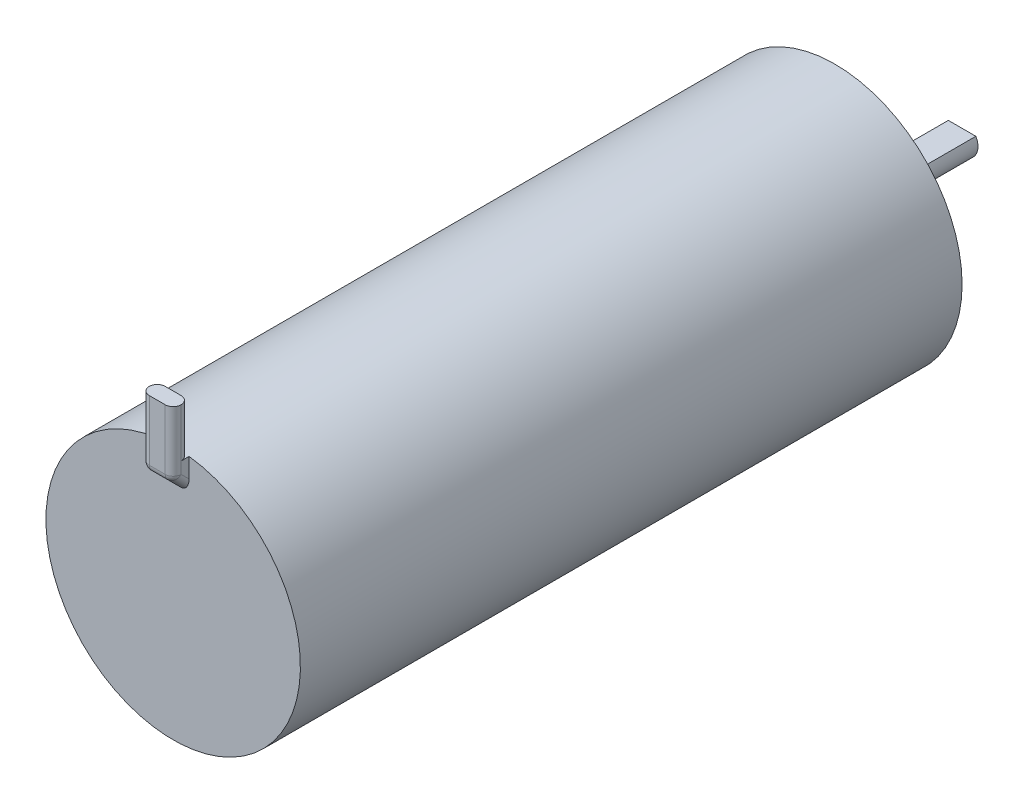
from build123d import *

# Parameters (mm, degrees)
SKETCH1_R           = 8
BOSS_EXTRUDE1_DEPTH = 41.6
SKETCH2_W           = 2
SKETCH2_H           = 5
BOSS_EXTRUDE2_DEPTH = 1
CHAMFER1_SIZE       = 1
FILLET1_R           = 0.5
FILLET2_R           = 0.5
SKETCH3_R           = 1
BOSS_EXTRUDE3_DEPTH = 8
SKETCH4_W           = 2.782468735
SKETCH4_H           = 1.387929773
CUT_EXTRUDE1_DEPTH  = 4


# Some blends are built 0.0001 mm under size
with BuildPart() as part:
    # Sketch1 → Boss-Extrude1 (new body)
    with BuildSketch(Plane.XY):
        Circle(SKETCH1_R)
    extrude(amount=BOSS_EXTRUDE1_DEPTH)

    # Sketch2 → Boss-Extrude2 (add)
    with BuildSketch(Plane.XY.offset(41.6)):
        with Locations((0, 8.5)):
            Rectangle(SKETCH2_W, SKETCH2_H)
    extrude(amount=BOSS_EXTRUDE2_DEPTH)

    # Chamfer1
    chamfer1_edges = [part.edges().sort_by_distance(p)[0] for p in [
        (0, 6, 42.6),
    ]]
    chamfer(chamfer1_edges, length=CHAMFER1_SIZE - 0.0001)  # a hair under: the kernel refuses the full size

    # Fillet1
    fillet1_edges = [part.edges().sort_by_distance(p)[0] for p in [
        (1, 8.99995, 42.6),
        (0, 6.9999, 42.6),
        (1, 6.49995, 42.10005),
        (-1, 6.49995, 42.10005),
        (-1, 8.99995, 42.6),
    ]]
    fillet(fillet1_edges, radius=FILLET1_R)

    # Fillet2
    # the kernel refuses this fillet: 0.5 mm, written as the material it takes off along each edge
    with BuildSketch(Plane(origin=(-1, 6.687253933, 41.6), x_dir=(0, 0, 1), z_dir=(0, 1, 0))) as fillet2_piece_1_section:
        with BuildLine():
            CenterArc((FILLET2_R, FILLET2_R), FILLET2_R, 180, 90)
            Line((0, FILLET2_R), (-FILLET2_R * 0.02, FILLET2_R))
            Line((-FILLET2_R * 0.02, FILLET2_R), (-FILLET2_R * 0.02, -FILLET2_R * 0.02))
            Line((-FILLET2_R * 0.02, -FILLET2_R * 0.02), (FILLET2_R, -FILLET2_R * 0.02))
            Line((FILLET2_R, -FILLET2_R * 0.02), (FILLET2_R, 0))
        make_face()
    fillet2_piece_1 = extrude(amount=4.312746067, mode=Mode.PRIVATE)
    fillet2_piece_1 = split(fillet2_piece_1, bisect_by=Plane(origin=(-0.898582018, 9.474400051, 41.6), z_dir=(0, 0, 1)), keep=Keep.TOP, mode=Mode.PRIVATE)
    fillet2_piece_1 = fillet2_piece_1 - Plane(origin=(0, 0, 41.723690259), x_dir=(1, 0, 0), z_dir=(0, 0, -1)) * Cylinder(8, 11, mode=Mode.PRIVATE)
    add(fillet2_piece_1, mode=Mode.SUBTRACT)
    with BuildSketch(Plane(origin=(1, 11, 41.6), x_dir=(-1, 0, 0), z_dir=(0, -1, 0))) as fillet2_piece_2_section:
        with BuildLine():
            CenterArc((FILLET2_R, -FILLET2_R), FILLET2_R, 90, 90)
            Line((0, -FILLET2_R), (-FILLET2_R * 0.02, -FILLET2_R))
            Line((-FILLET2_R * 0.02, -FILLET2_R), (-FILLET2_R * 0.02, FILLET2_R * 0.02))
            Line((-FILLET2_R * 0.02, FILLET2_R * 0.02), (FILLET2_R, FILLET2_R * 0.02))
            Line((FILLET2_R, FILLET2_R * 0.02), (FILLET2_R, 0))
        make_face()
    fillet2_piece_2 = extrude(amount=4.312746067, mode=Mode.PRIVATE)
    fillet2_piece_2 = split(fillet2_piece_2, bisect_by=Plane(origin=(0.898581764, 9.474398488, 41.6), z_dir=(0, 0, 1)), keep=Keep.TOP, mode=Mode.PRIVATE)
    fillet2_piece_2 = fillet2_piece_2 - Plane(origin=(0, 0, 41.723690294), x_dir=(1, 0, 0), z_dir=(0, 0, -1)) * Cylinder(8, 11, mode=Mode.PRIVATE)
    add(fillet2_piece_2, mode=Mode.SUBTRACT)

    # Sketch3 → Boss-Extrude3 (add)
    with BuildSketch(Plane(origin=(0, 0, 0), x_dir=(-1, 0, 0), z_dir=(0, 0, -1))):
        with Locations(Location((0, 0, 0), (0, 0, 180))):
            Circle(SKETCH3_R)
    extrude(amount=BOSS_EXTRUDE3_DEPTH)

    # Sketch4 → Cut-Extrude1 (cut)
    with BuildSketch(Plane(origin=(0, 0, -8), x_dir=(-1, 0, 0), z_dir=(0, 0, -1))):
        with Locations((0.104073174, 1.193964887)):
            Rectangle(SKETCH4_W, SKETCH4_H)
    extrude(amount=-CUT_EXTRUDE1_DEPTH, mode=Mode.SUBTRACT)


solid = part.part
